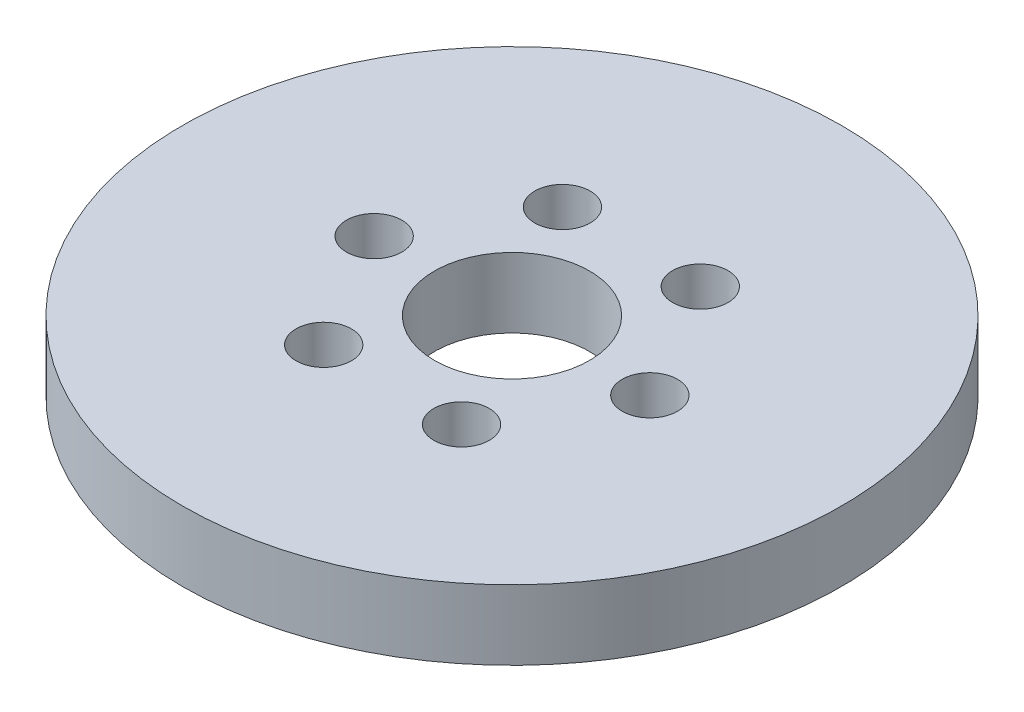
from build123d import *

# Parameters (mm, degrees)
SKETCH1_R           = 85
BOSS_EXTRUDE1_DEPTH = 18
SKETCH2_R           = 20
CUT_EXTRUDE1_DEPTH  = 122.548344291
SKETCH3_R           = 7.148012691
CUT_EXTRUDE2_DEPTH  = 14.31519946
CIRPATTERN1_COUNT   = 6


with BuildPart() as part:
    # Sketch1 → Boss-Extrude1 (new body)
    with BuildSketch(Plane(origin=(0, 0, 0), x_dir=(1, 0, 0), z_dir=(0, 1, 0))):
        Circle(SKETCH1_R)
    extrude(amount=BOSS_EXTRUDE1_DEPTH)

    # Sketch2 → Cut-Extrude1 (cut, through all)
    with BuildSketch(Plane(origin=(0, 0, 0), x_dir=(1, 0, 0), z_dir=(0, 1, 0))):
        Circle(SKETCH2_R)
    extrude(amount=CUT_EXTRUDE1_DEPTH, mode=Mode.SUBTRACT)

    # Sketch3 → Cut-Extrude2 (cut)
    with BuildSketch(Plane(origin=(0, 18, 0), x_dir=(1, 0, 0), z_dir=(0, 1, 0))):
        with Locations((-35.551366429, 0)):
            Circle(SKETCH3_R)
    cut_extrude2 = extrude(amount=-CUT_EXTRUDE2_DEPTH, mode=Mode.SUBTRACT)

    # CirPattern1: Cut-Extrude2 ×6 about axis
    cirpattern1_axis = Axis((0, 0, 0), (0, 1, 0))
    for i in range(1, CIRPATTERN1_COUNT):
        add(cut_extrude2.rotate(cirpattern1_axis, i * 360 / CIRPATTERN1_COUNT), mode=Mode.SUBTRACT)


solid = part.part
